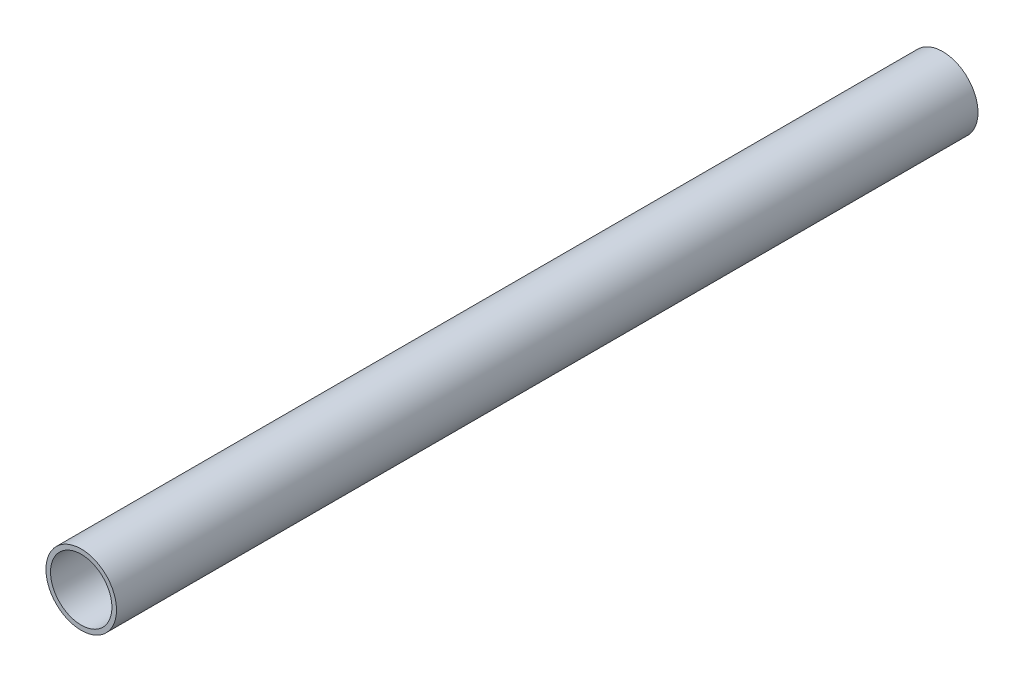
from build123d import *

# Parameters (mm, degrees)
SKETCH1_R           = 30.1625
SKETCH1_R_2         = 26.2509
BOSS_EXTRUDE1_DEPTH = 736.6


with BuildPart() as part:
    # Sketch1 → Boss-Extrude1 (new body)
    with BuildSketch(Plane.XY):
        Circle(SKETCH1_R)
        Circle(SKETCH1_R_2, mode=Mode.SUBTRACT)
    extrude(amount=BOSS_EXTRUDE1_DEPTH)


solid = part.part
